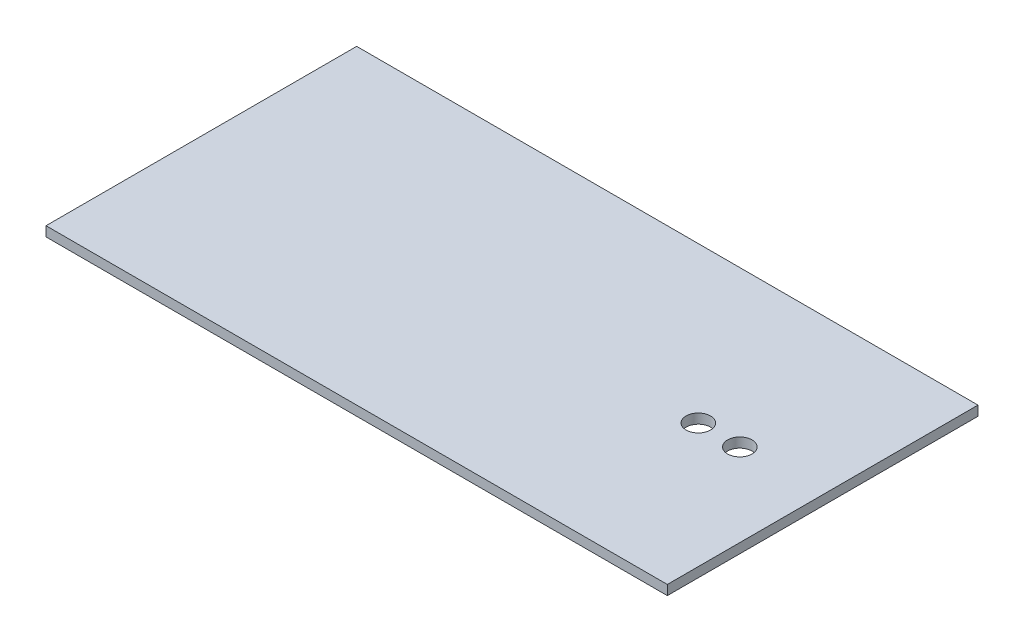
from build123d import *

# Parameters (mm, degrees)
SKETCH1_W           = 101.6
SKETCH1_H           = 50.8
BOSS_EXTRUDE1_DEPTH = 1.5875
SKETCH2_R           = 2
CUT_EXTRUDE1_DEPTH  = 57.818308284


with BuildPart() as part:
    # Sketch1 → Boss-Extrude1 (new body)
    with BuildSketch(Plane(origin=(0, 0, 0), x_dir=(1, 0, 0), z_dir=(0, 1, 0))):
        Rectangle(SKETCH1_W, SKETCH1_H)
    extrude(amount=BOSS_EXTRUDE1_DEPTH)

    # Sketch2 → Cut-Extrude1 (cut, through all)
    with BuildSketch(Plane(origin=(0, 1.5875, 0), x_dir=(1, 0, 0), z_dir=(0, 1, 0))):
        with Locations((37.251826486, 0)):
            Circle(SKETCH2_R)
        with Locations((30.470026486, 0)):
            Circle(SKETCH2_R)
    extrude(amount=-CUT_EXTRUDE1_DEPTH, mode=Mode.SUBTRACT)


solid = part.part
